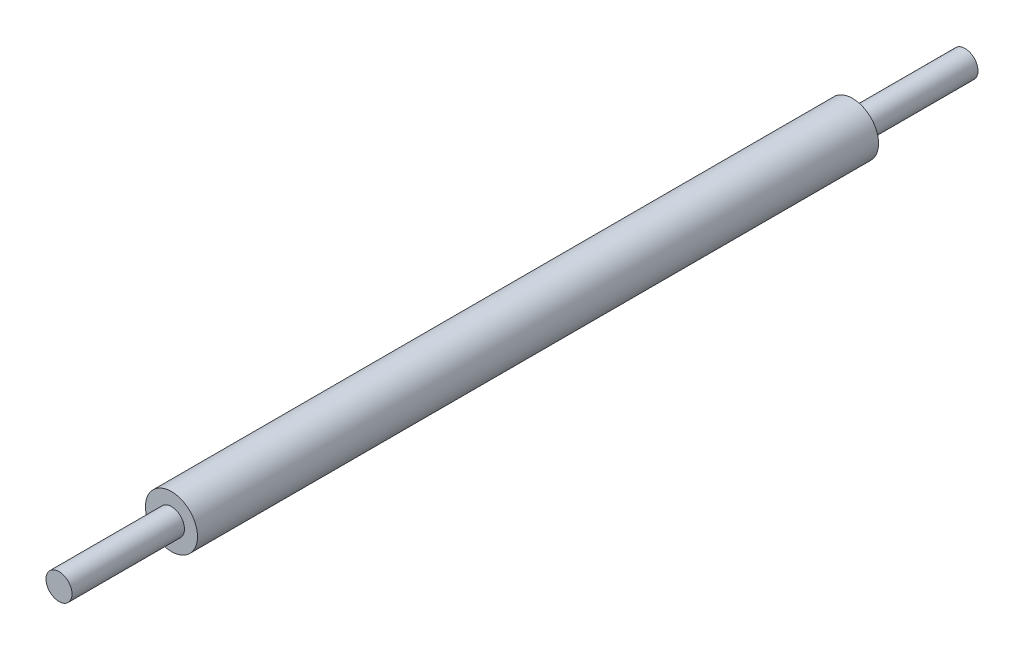
from build123d import *

# Parameters (mm, degrees)
SKETCH2_R           = 6.35
BOSS_EXTRUDE1_DEPTH = 220.98
CUT_EXTRUDE1_START  = -26.416
SKETCH3_R           = 6.35
CUT_EXTRUDE1_DEPTH  = 26.416
SKETCH4_R           = 3.175
BOSS_EXTRUDE2_DEPTH = 26.416
SKETCH5_R           = 6.35
CUT_EXTRUDE2_DEPTH  = 26.416
BOSS_EXTRUDE3_START = 26.416
SKETCH6_R           = 3.175
BOSS_EXTRUDE3_DEPTH = 26.416
SKETCH7_R           = 14.230994678
CUT_EXTRUDE3_DEPTH  = 27.432
BOSS_EXTRUDE4_START = 27.432
SKETCH8_R           = 3.175
BOSS_EXTRUDE4_DEPTH = 27.432
SKETCH9_R           = 8.837420976
CUT_EXTRUDE4_DEPTH  = 27.432
SKETCH10_R          = 3.175
BOSS_EXTRUDE5_DEPTH = 27.432


with BuildPart() as part:
    # Sketch2 → Boss-Extrude1 (new body)
    with BuildSketch(Plane.XY):
        Circle(SKETCH2_R)
    extrude(amount=BOSS_EXTRUDE1_DEPTH)

    # Sketch3 → Cut-Extrude1 (cut)
    with BuildSketch(Plane.XY.offset(220.98).offset(CUT_EXTRUDE1_START)):
        Circle(SKETCH3_R)
    extrude(amount=CUT_EXTRUDE1_DEPTH, mode=Mode.SUBTRACT)

    # Sketch4 → Boss-Extrude2 (add)
    with BuildSketch(Plane.XY.offset(194.564)):
        Circle(SKETCH4_R)
    extrude(amount=BOSS_EXTRUDE2_DEPTH)

    # Sketch5 → Cut-Extrude2 (cut)
    with BuildSketch(Plane(origin=(0, 0, 0), x_dir=(-1, 0, 0), z_dir=(0, 0, -1))):
        Circle(SKETCH5_R)
    extrude(amount=-CUT_EXTRUDE2_DEPTH, mode=Mode.SUBTRACT)

    # Sketch6 → Boss-Extrude3 (add)
    with BuildSketch(Plane(origin=(0, 0, 26.416), x_dir=(-1, 0, 0), z_dir=(0, 0, -1)).offset(BOSS_EXTRUDE3_START)):
        Circle(SKETCH6_R)
    extrude(amount=-BOSS_EXTRUDE3_DEPTH)

    # Sketch7 → Cut-Extrude3 (cut)
    with BuildSketch(Plane(origin=(0, 0, 0), x_dir=(-1, 0, 0), z_dir=(0, 0, -1))):
        Circle(SKETCH7_R)
    extrude(amount=-CUT_EXTRUDE3_DEPTH, mode=Mode.SUBTRACT)

    # Sketch8 → Boss-Extrude4 (add)
    with BuildSketch(Plane(origin=(0, 0, 27.432), x_dir=(-1, 0, 0), z_dir=(0, 0, -1)).offset(BOSS_EXTRUDE4_START)):
        Circle(SKETCH8_R)
    extrude(amount=-BOSS_EXTRUDE4_DEPTH)

    # Sketch9 → Cut-Extrude4 (cut)
    with BuildSketch(Plane.XY.offset(220.98)):
        Circle(SKETCH9_R)
    extrude(amount=-CUT_EXTRUDE4_DEPTH, mode=Mode.SUBTRACT)

    # Sketch10 → Boss-Extrude5 (add)
    with BuildSketch(Plane.XY.offset(193.548)):
        Circle(SKETCH10_R)
    extrude(amount=BOSS_EXTRUDE5_DEPTH)


solid = part.part
